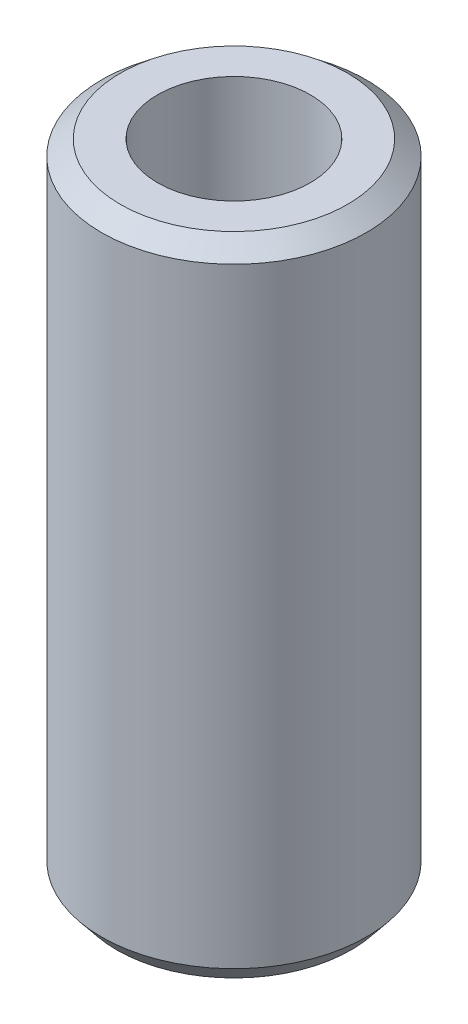
from build123d import *
from OCP.BRepFilletAPI import BRepFilletAPI_MakeChamfer

# Parameters (mm, degrees)
SKETCH1_R           = 47.5
BOSS_EXTRUDE1_DEPTH = 231.038125928
SKETCH2_R           = 27.39405949
CUT_EXTRUDE1_DEPTH  = 241.605726516
CHAMFER1_SIZE       = 5.42246719
CHAMFER1_SIZE2      = 6.718598853


with BuildPart() as part:
    # Sketch1 → Boss-Extrude1 (new body)
    with BuildSketch(Plane(origin=(0, 0, 0), x_dir=(1, 0, 0), z_dir=(0, 1, 0))):
        Circle(SKETCH1_R)
    extrude(amount=BOSS_EXTRUDE1_DEPTH)

    # Sketch2 → Cut-Extrude1 (cut, through all)
    with BuildSketch(Plane(origin=(0, 0, 0), x_dir=(1, 0, 0), z_dir=(0, 1, 0))):
        Circle(SKETCH2_R)
    extrude(amount=CUT_EXTRUDE1_DEPTH, mode=Mode.SUBTRACT)

    # Chamfer1: one chamfer whose edges measure the first distance from different faces: ONE call of the kernel's chamfer builder (chamfer() names one face for all edges)
    chamfer1_edges_1 = [part.edges().sort_by_distance(p)[0] for p in [
        (-47.5, 231.038125928, 0),
    ]]
    chamfer1_side_1 = [part.faces().sort_by_distance(p)[0] for p in [
        (-47.5, 115.519062964, 0),
    ]]
    chamfer1_edges_2 = [part.edges().sort_by_distance(p)[0] for p in [
        (-47.5, 0, 0),
    ]]
    chamfer1_side_2 = [part.faces().sort_by_distance(p)[0] for p in [
        (-46.156497116, 0, 0),
    ]]
    chamfer1 = BRepFilletAPI_MakeChamfer(part.part.solid().wrapped)
    for e in chamfer1_edges_1:
        chamfer1.Add(CHAMFER1_SIZE, CHAMFER1_SIZE2, e.wrapped, chamfer1_side_1[0].wrapped)  # the first distance lies on this face
    for e in chamfer1_edges_2:
        chamfer1.Add(CHAMFER1_SIZE, CHAMFER1_SIZE2, e.wrapped, chamfer1_side_2[0].wrapped)  # the first distance lies on this face
    add(Compound.cast(chamfer1.Shape()), mode=Mode.REPLACE)


solid = part.part
